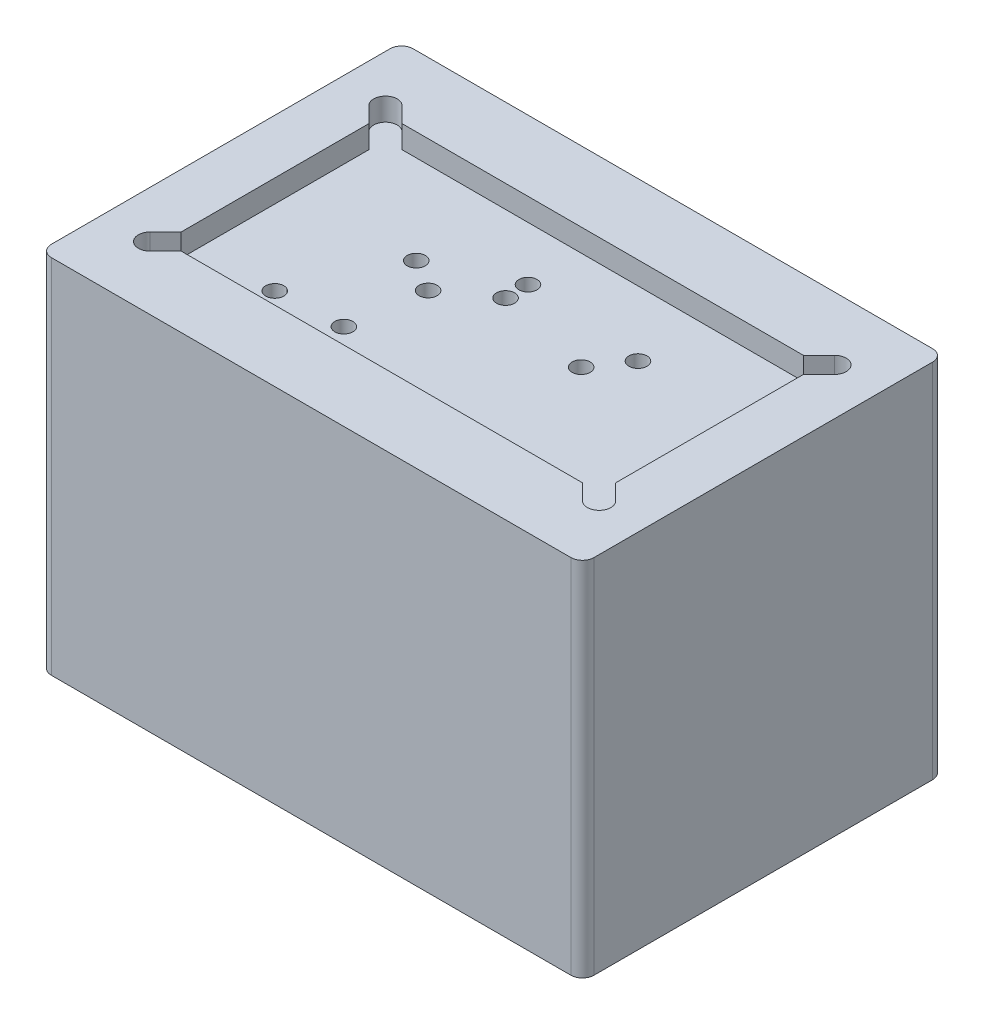
from build123d import *

# Parameters (mm, degrees)
SKETCH1_W           = 38.1
SKETCH1_H           = 25.4
BOSS_EXTRUDE1_DEPTH = 25.4
SKETCH4_R           = 0.635
CUT_EXTRUDE1_DEPTH  = 35.195796525
CUT_EXTRUDE2_DEPTH  = 1.5875
CUT_EXTRUDE3_DEPTH  = 3.175
FILLET1_R           = 3.302
FILLET2_R           = 0.8128
CHAMFER1_SIZE       = 0.635


with BuildPart() as part:
    # Sketch1 → Boss-Extrude1 (new body)
    with BuildSketch(Plane(origin=(0, 0, 0), x_dir=(1, 0, 0), z_dir=(0, 1, 0))):
        Rectangle(SKETCH1_W, SKETCH1_H)
    extrude(amount=BOSS_EXTRUDE1_DEPTH)

    # Sketch4 → Cut-Extrude1 (cut, through all)
    with BuildSketch(Plane(origin=(0, 25.4, 0), x_dir=(1, 0, 0), z_dir=(0, 1, 0))):
        with Locations(Location((-9.9568, -5.2959, 0), (0, 0, 270))):
            Circle(SKETCH4_R)
        with Locations(Location((-5.3594, -5.0419, 0), (0, 0, 270))):
            Circle(SKETCH4_R)
        with Locations(Location((-4.5974, 0.1143, 0), (0, 0, 270))):
            Circle(SKETCH4_R)
        with Locations(Location((-6.8326, 1.5113, 0), (0, 0, 270))):
            Circle(SKETCH4_R)
        with Locations(Location((-1.4478, 3.9751, 0), (0, 0, 270))):
            Circle(SKETCH4_R)
        with Locations(Location((-1.4224, 2.3749, 0), (0, 0, 270))):
            Circle(SKETCH4_R)
        with Locations(Location((5.4356, 0.8255, 0), (0, 0, 270))):
            Circle(SKETCH4_R)
        with Locations(Location((7.0612, 3.1877, 0), (0, 0, 270))):
            Circle(SKETCH4_R)
    extrude(amount=-CUT_EXTRUDE1_DEPTH, mode=Mode.SUBTRACT)

    # Sketch5 → Cut-Extrude2 (cut)
    with BuildSketch(Plane(origin=(0, 25.4, 0), x_dir=(1, 0, 0), z_dir=(0, 1, 0))):
        with BuildLine():
            Line((-15.164283352, 8.851416648), (-14.072566704, 7.7597))
            Line((-14.072566704, 7.7597), (14.100557504, 7.7597))
            Line((14.100557504, 7.7597), (15.192274152, 8.851416648))
            ThreePointArc((15.192274152, 8.851416648), (16.359707448, 8.851416648), (16.359707448, 7.683983352))
            Line((16.359707448, 7.683983352), (15.2679908, 6.592266704))
            Line((15.2679908, 6.592266704), (15.2679908, -6.580862104))
            Line((15.2679908, -6.580862104), (16.359707448, -7.672578752))
            ThreePointArc((16.359707448, -7.672578752), (16.359707448, -8.840012048), (15.192274152, -8.840012048))
            Line((15.192274152, -8.840012048), (14.100557504, -7.7482954))
            Line((14.100557504, -7.7482954), (-14.072566704, -7.7482954))
            Line((-14.072566704, -7.7482954), (-15.164283352, -8.840012048))
            ThreePointArc((-15.164283352, -8.840012048), (-16.331716648, -8.840012048), (-16.331716648, -7.672578752))
            Line((-16.331716648, -7.672578752), (-15.24, -6.580862104))
            Line((-15.24, -6.580862104), (-15.24, 6.592266704))
            Line((-15.24, 6.592266704), (-16.331716648, 7.683983352))
            ThreePointArc((-16.331716648, 7.683983352), (-16.331716648, 8.851416648), (-15.164283352, 8.851416648))
        make_face()
    extrude(amount=-CUT_EXTRUDE2_DEPTH, mode=Mode.SUBTRACT)

    # Sketch6 → Cut-Extrude3 (cut)
    with BuildSketch(Plane.XZ):
        Polygon((-19.05, -3.175), (-19.05, 3.175), (-16.51, 3.175), (-16.51, 10.16), (16.51, 10.16), (16.51, -10.16), (-16.51, -10.16), (-16.51, -3.175), align=None)
    extrude(amount=-CUT_EXTRUDE3_DEPTH, mode=Mode.SUBTRACT)

    # Fillet1
    fillet1_edges = [part.edges().sort_by_distance(p)[0] for p in [
        (-16.51, 1.5875, 10.16),
        (16.51, 1.5875, 10.16),
        (16.51, 1.5875, -10.16),
        (-16.51, 1.5875, -10.16),
    ]]
    fillet(fillet1_edges, radius=FILLET1_R)

    # Fillet2
    fillet2_edges = [part.edges().sort_by_distance(p)[0] for p in [
        (-16.51, 1.5875, 3.175),
        (-16.51, 1.5875, -3.175),
        (-19.05, 12.7, -12.7),
        (19.05, 12.7, -12.7),
        (19.05, 12.7, 12.7),
        (-19.05, 12.7, 12.7),
    ]]
    fillet(fillet2_edges, radius=FILLET2_R)

    # Chamfer1
    # the kernel refuses this chamfer: 0.635 mm, written as the material it takes off along each edge
    with BuildSketch(Plane(origin=(-5.3594, 3.175, 5.0419), x_dir=(0, 0, 1), z_dir=(-1, 0, 0))) as chamfer1_piece_1:
        Polygon((0.635 + CHAMFER1_SIZE, 0), (0.635, CHAMFER1_SIZE), (0.635, 0), align=None)
    revolve(axis=Axis((-5.3594, 3.175, 5.0419), (0, 1, 0)), mode=Mode.SUBTRACT)
    with BuildSketch(Plane(origin=(-6.8326, 3.175, -1.5113), x_dir=(0, 0, 1), z_dir=(-1, 0, 0))) as chamfer1_piece_2:
        Polygon((0.635 + CHAMFER1_SIZE, 0), (0.635, CHAMFER1_SIZE), (0.635, 0), align=None)
    revolve(axis=Axis((-6.8326, 3.175, -1.5113), (0, 1, 0)), mode=Mode.SUBTRACT)
    with BuildSketch(Plane(origin=(-1.4224, 3.175, -2.3749), x_dir=(0, 0, 1), z_dir=(-1, 0, 0))) as chamfer1_piece_3:
        Polygon((0.635 + CHAMFER1_SIZE, 0), (0.635, CHAMFER1_SIZE), (0.635, 0), align=None)
    revolve(axis=Axis((-1.4224, 3.175, -2.3749), (0, 1, 0)), mode=Mode.SUBTRACT)
    with BuildSketch(Plane(origin=(7.0612, 3.175, -3.1877), x_dir=(0, 0, 1), z_dir=(-1, 0, 0))) as chamfer1_piece_4:
        Polygon((0.635 + CHAMFER1_SIZE, 0), (0.635, CHAMFER1_SIZE), (0.635, 0), align=None)
    revolve(axis=Axis((7.0612, 3.175, -3.1877), (0, 1, 0)), mode=Mode.SUBTRACT)
    with BuildSketch(Plane(origin=(5.4356, 3.175, -0.8255), x_dir=(0, 0, 1), z_dir=(-1, 0, 0))) as chamfer1_piece_5:
        Polygon((0.635 + CHAMFER1_SIZE, 0), (0.635, CHAMFER1_SIZE), (0.635, 0), align=None)
    revolve(axis=Axis((5.4356, 3.175, -0.8255), (0, 1, 0)), mode=Mode.SUBTRACT)
    with BuildSketch(Plane(origin=(-1.4478, 3.175, -3.9751), x_dir=(0, 0, 1), z_dir=(-1, 0, 0))) as chamfer1_piece_6:
        Polygon((0.635 + CHAMFER1_SIZE, 0), (0.635, CHAMFER1_SIZE), (0.635, 0), align=None)
    revolve(axis=Axis((-1.4478, 3.175, -3.9751), (0, 1, 0)), mode=Mode.SUBTRACT)
    with BuildSketch(Plane(origin=(-4.5974, 3.175, -0.1143), x_dir=(0, 0, 1), z_dir=(-1, 0, 0))) as chamfer1_piece_7:
        Polygon((0.635 + CHAMFER1_SIZE, 0), (0.635, CHAMFER1_SIZE), (0.635, 0), align=None)
    revolve(axis=Axis((-4.5974, 3.175, -0.1143), (0, 1, 0)), mode=Mode.SUBTRACT)
    with BuildSketch(Plane(origin=(-9.9568, 3.175, 5.2959), x_dir=(0, 0, 1), z_dir=(-1, 0, 0))) as chamfer1_piece_8:
        Polygon((0.635 + CHAMFER1_SIZE, 0), (0.635, CHAMFER1_SIZE), (0.635, 0), align=None)
    revolve(axis=Axis((-9.9568, 3.175, 5.2959), (0, 1, 0)), mode=Mode.SUBTRACT)


solid = part.part
